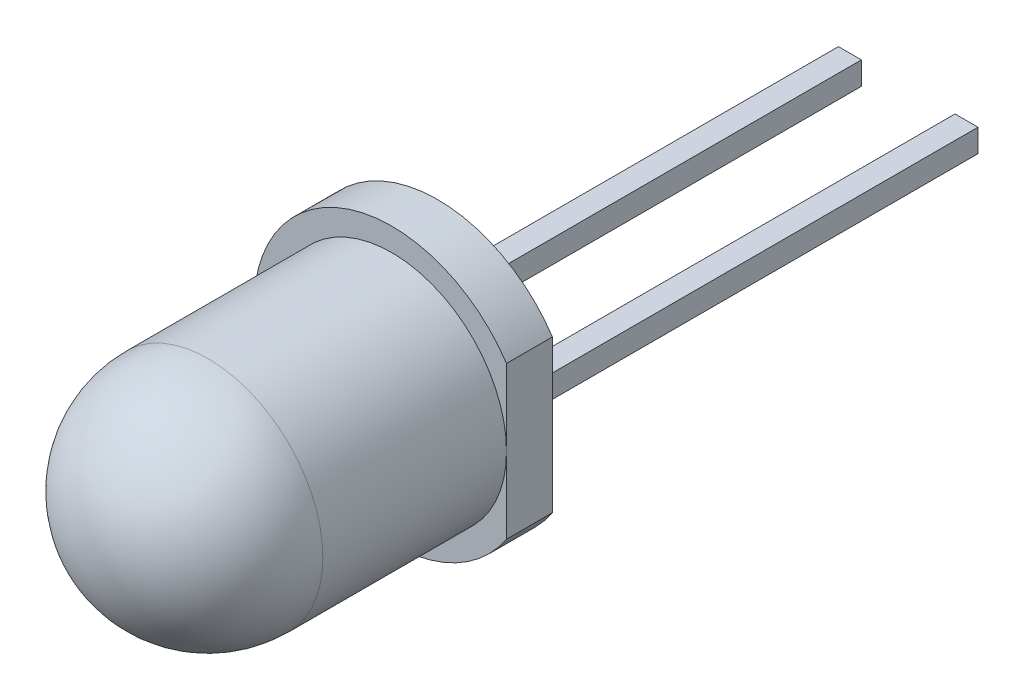
from build123d import *

# Parameters (mm, degrees)
SKETCH1_R           = 3
BOSS_EXTRUDE1_DEPTH = 1
SKETCH2_R           = 2.5
BOSS_EXTRUDE2_DEPTH = 4
DOME1_FACE_RADIUS   = 2.5
DOME1_HEIGHT        = 2.5
CUT_EXTRUDE1_REACH  = 9.762
SKETCH3_W           = 0.5
SKETCH3_H           = 4.031292186
SKETCH8_W           = 0.5
SKETCH8_H           = 10
BASE_FLANGE1_DEPTH  = 0.25
SKETCH9_W           = 0.5
SKETCH9_H           = 10
BASE_FLANGE2_DEPTH  = 0.25


# Sheet-metal steps are written as plain solids
with BuildPart() as part:
    # Sketch1 → Boss-Extrude1 (new body)
    with BuildSketch(Plane.XY):
        Circle(SKETCH1_R)
    extrude(amount=BOSS_EXTRUDE1_DEPTH)

    # Sketch2 → Boss-Extrude2 (add)
    with BuildSketch(Plane.XY.offset(1)):
        Circle(SKETCH2_R)
    extrude(amount=BOSS_EXTRUDE2_DEPTH)

    # Dome1: a dome of height H over a round flat face of radius A is a cap of a sphere of radius (A * A + H * H) / (2 * H)
    dome1_r = (DOME1_FACE_RADIUS * DOME1_FACE_RADIUS + DOME1_HEIGHT * DOME1_HEIGHT) / (2 * DOME1_HEIGHT)
    dome1_base = Plane((0, 0, 5), z_dir=(0, 0, 1))
    with Locations(dome1_base.offset(DOME1_HEIGHT - dome1_r)):
        dome1_ball = Sphere(dome1_r, mode=Mode.PRIVATE)
    add(split(dome1_ball, bisect_by=dome1_base, keep=Keep.TOP, mode=Mode.PRIVATE))

    # Sketch3 → Cut-Extrude1 (cut, up to next)
    with BuildSketch(Plane.XY.offset(1), mode=Mode.PRIVATE) as cut_extrude1_sk1:
        with Locations((2.75, -0.165370345)):
            Rectangle(SKETCH3_W, SKETCH3_H)
    cut_extrude1_tool1 = extrude(cut_extrude1_sk1.sketch, amount=-CUT_EXTRUDE1_REACH, mode=Mode.PRIVATE) & part.part
    add(cut_extrude1_tool1.solids().sort_by_distance((2.75, -0.16537, 1))[0], mode=Mode.SUBTRACT)


with BuildPart() as body_2:
    # Sketch8 → Base-Flange1 (new, symmetric)
    with BuildSketch(Plane(origin=(0, 0, 0), x_dir=(1, 0, 0), z_dir=(0, 1, 0))):
        with Locations((-1.02, 5)):
            Rectangle(SKETCH8_W, SKETCH8_H)
    extrude(amount=BASE_FLANGE1_DEPTH, both=True)


with BuildPart() as body_3:
    # Sketch9 → Base-Flange2 (new, symmetric)
    with BuildSketch(Plane(origin=(0, 0, 0), x_dir=(1, 0, 0), z_dir=(0, 1, 0))):
        with Locations((1.52, 5)):
            Rectangle(SKETCH9_W, SKETCH9_H)
    extrude(amount=BASE_FLANGE2_DEPTH, both=True)


solid = Compound([part.part, body_2.part, body_3.part])
